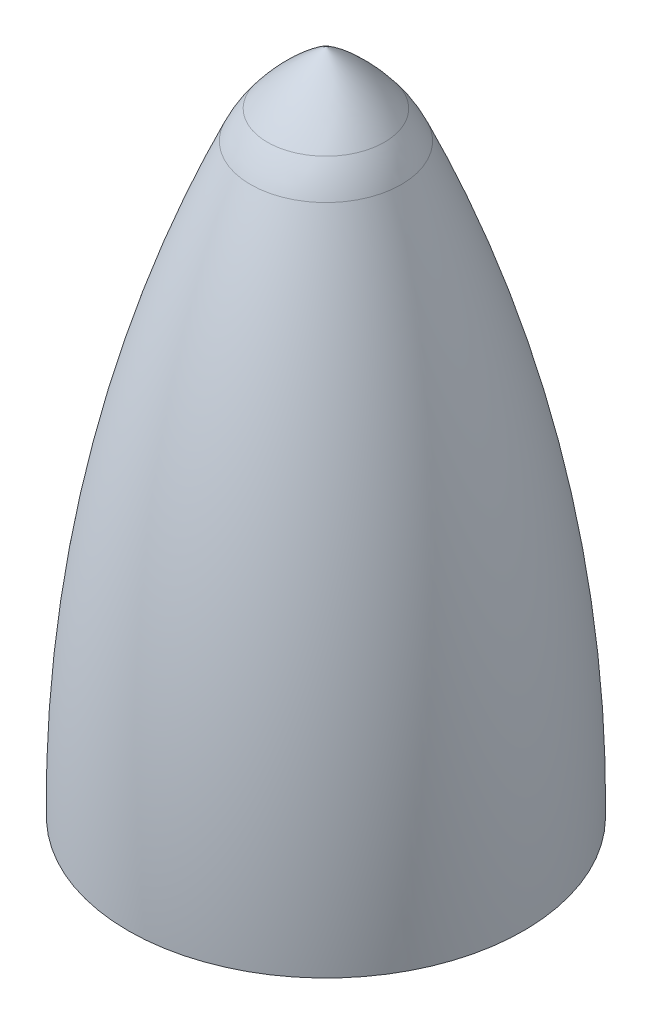
from build123d import *

# Parameters (mm, degrees)
SKETCH1_R           = 38.85
BOSS_EXTRUDE1_DEPTH = 5
FILLET1_R           = 30
SKETCH5_R           = 42.4
CUT_EXTRUDE1_DEPTH  = 7
SKETCH6_R           = 4.5
BOSS_EXTRUDE2_DEPTH = 10
THREAD1_PITCH       = 2.5
CUT_EXTRUDE2_START  = -1
SKETCH9_R           = 4.5
CUT_EXTRUDE2_DEPTH  = 1


with BuildPart() as part:
    # Sketch1 → Boss-Extrude1 (new body)
    with BuildSketch(Plane(origin=(0, 0, 0), x_dir=(1, 0, 0), z_dir=(0, 1, 0))):
        with Locations(Location((0, 0, 0), (0, 0, 270))):
            Circle(SKETCH1_R)
    extrude(amount=BOSS_EXTRUDE1_DEPTH)

    # Sketch4 → Revolve1 (revolve)
    with BuildSketch(Plane.XY, mode=Mode.PRIVATE) as revolve1_sk:
        with BuildLine():
            Line((0, 5), (0, 7))
            Line((0, 7), (-39.35, 7))
            ThreePointArc((-39.35, 7), (-32.740854256, 72.509774327), (-12, 135))
            Line((-12, 135), (0, 135))
            Line((0, 135), (0, 150))
            ThreePointArc((0, 150), (-8.304651657, 143.304651657), (-15, 135))
            ThreePointArc((-15, 135), (-35.961236464, 71.532912056), (-42.35, 5))
            Line((-42.35, 5), (0, 5))
        make_face()
    revolve(revolve1_sk.sketch.rotate(Axis((0, 5, 0), (0, 1, 0)), 270), axis=Axis((0, 5, 0), (0, 1, 0)))

    # Fillet1
    fillet1_edges = [part.edges().sort_by_distance(p)[0] for p in [
        (0, 135, 15),
    ]]
    fillet(fillet1_edges, radius=FILLET1_R)

    # Sketch5 → Cut-Extrude1 (cut)
    with BuildSketch(Plane(origin=(0, 0, 0), x_dir=(1, 0, 0), z_dir=(0, 1, 0))):
        Circle(SKETCH5_R)
    extrude(amount=CUT_EXTRUDE1_DEPTH, mode=Mode.SUBTRACT)

    # Sketch6 → Boss-Extrude2 (add)
    with BuildSketch(Plane.XZ.offset(-135)):
        with Locations(Location((0, 0, 0), (0, 0, 90))):
            Circle(SKETCH6_R)
    extrude(amount=BOSS_EXTRUDE2_DEPTH)

    # Thread1: the profile of Thread Profile1 profile screwed along a right-hand helix of 4 turns, 10 arcs to a turn; built about Z, then put on its axis
    thread1_z = Axis((0, 0, 0), (0, 0, 1))
    thread1_corners = [(4.5003, 0, -0.000173205), (4.5003, 0, 2.187673198), (3.146835313, 0, 1.406249997), (3.146835313, 0, 0.781249997)]
    with BuildLine(mode=Mode.PRIVATE) as thread1_profile:
        Line(thread1_corners[0], thread1_corners[1])
        Line(thread1_corners[1], thread1_corners[2])
        Line(thread1_corners[2], thread1_corners[3])
        Line(thread1_corners[3], thread1_corners[0])
    thread1_cap = Face(thread1_profile.wire())
    thread1_turn_angles = [0, 18, 36, 54, 72, 90, 108, 126, 144, 162, 180, 198, 216, 234, 252, 270, 288, 306, 324, 342, 360]
    thread1_turn_weights = [1, 0.9510565162951535, 1, 0.9510565162951535, 1, 0.9510565162951535, 1, 0.9510565162951535, 1, 0.9510565162951535, 1, 0.9510565162951535, 1, 0.9510565162951535, 1, 0.9510565162951535, 1, 0.9510565162951535, 1, 0.9510565162951535, 1]
    thread1_turn_rails = [Edge.make_bspline([Vector(p[0], p[1], 0).rotate(thread1_z, thread1_turn_angles[k]) / thread1_turn_weights[k] + Vector(0, 0, p[2] + THREAD1_PITCH * thread1_turn_angles[k] / 360) for k in range(21)], [0, 0, 0, 1, 1, 2, 2, 3, 3, 4, 4, 5, 5, 6, 6, 7, 7, 8, 8, 9, 9, 10, 10, 10], 2, thread1_turn_weights) for p in thread1_corners]
    thread1_turn_sides = [Face.make_surface_from_curves(thread1_turn_rails[p[0]], thread1_turn_rails[p[1]]) for p in [(0, 1), (1, 2), (2, 3), (3, 0)]]
    thread1 = Plane(origin=(0, 125, 0), x_dir=(1, 0, 0), z_dir=(0, 1, 0)) * Solid(Shell([*[p.moved(Location((0, 0, THREAD1_PITCH * i))) for i in range(4) for p in thread1_turn_sides], thread1_cap, thread1_cap.rotate(thread1_z, 1440).moved(Location((0, 0, THREAD1_PITCH * 1440 / 360)))]))
    add(thread1, mode=Mode.SUBTRACT)

    # Sketch9 → Cut-Extrude2 (cut)
    with BuildSketch(Plane.XZ.offset(-125).offset(CUT_EXTRUDE2_START)):
        Circle(SKETCH9_R)
    extrude(amount=CUT_EXTRUDE2_DEPTH, mode=Mode.SUBTRACT)


solid = part.part
